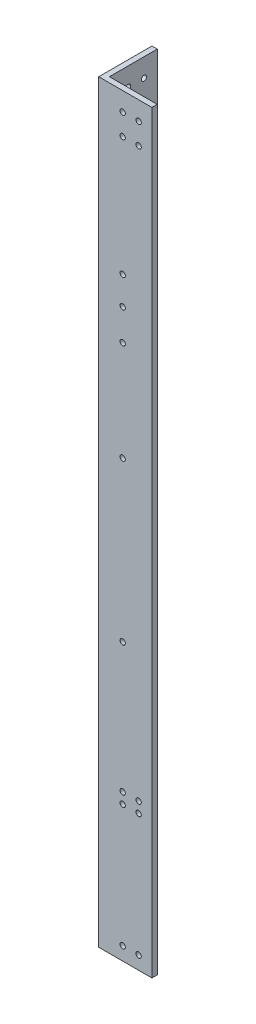
from build123d import *

# Parameters (mm, degrees)
BOSS_EXTRUDE1_DEPTH               = 450
FRONTSIDEHOLES_SKETCH3_R          = 1.5875
FRONTSIDEHOLES_CUT_EXTRUDE1_DEPTH = 3.175
LEFTSIDEHOLES_SKETCH4_R           = 1.5875
LEFTSIDEHOLES_CUT_EXTRUDE2_DEPTH  = 3.175


with BuildPart() as part:
    # Sketch2 → Boss-Extrude1 (new body)
    with BuildSketch(Plane(origin=(0, 0, 0), x_dir=(1, 0, 0), z_dir=(0, 1, 0))):
        Polygon((0, 31.75), (3.175, 31.75), (3.175, 3.175), (31.75, 3.175), (31.75, 0), (0, 0), align=None)
    extrude(amount=BOSS_EXTRUDE1_DEPTH)

    # FrontSideHoles-Sketch3 → FrontSideHoles-Cut-Extrude1 (cut)
    with BuildSketch(Plane.XY):
        with Locations((14.2875, 81.1125)):
            Circle(FRONTSIDEHOLES_SKETCH3_R)
        with Locations((23.8125, 81.1125)):
            Circle(FRONTSIDEHOLES_SKETCH3_R)
        with Locations((14.2875, 87.4625)):
            Circle(FRONTSIDEHOLES_SKETCH3_R)
        with Locations((23.8125, 87.4625)):
            Circle(FRONTSIDEHOLES_SKETCH3_R)
        with Locations((14.2875, 438.8875)):
            Circle(FRONTSIDEHOLES_SKETCH3_R)
        with Locations((14.2875, 426.1875)):
            Circle(FRONTSIDEHOLES_SKETCH3_R)
        with Locations((23.8125, 438.8875)):
            Circle(FRONTSIDEHOLES_SKETCH3_R)
        with Locations((23.8125, 426.1875)):
            Circle(FRONTSIDEHOLES_SKETCH3_R)
        with Locations((14.2875, 338.177644)):
            Circle(FRONTSIDEHOLES_SKETCH3_R)
        with Locations((14.2875, 319.652644)):
            Circle(FRONTSIDEHOLES_SKETCH3_R)
        with Locations((14.2875, 260)):
            Circle(FRONTSIDEHOLES_SKETCH3_R)
        with Locations((14.2875, 165)):
            Circle(FRONTSIDEHOLES_SKETCH3_R)
        with Locations((14.2875, 355)):
            Circle(FRONTSIDEHOLES_SKETCH3_R)
        with Locations((14.2875, 7.9375)):
            Circle(FRONTSIDEHOLES_SKETCH3_R)
        with Locations((23.8125, 7.9375)):
            Circle(FRONTSIDEHOLES_SKETCH3_R)
    extrude(amount=-FRONTSIDEHOLES_CUT_EXTRUDE1_DEPTH, mode=Mode.SUBTRACT)

    # LeftSideHoles-Sketch4 → LeftSideHoles-Cut-Extrude2 (cut)
    with BuildSketch(Plane.ZY):
        with Locations((-23.8125, 81.1125)):
            Circle(LEFTSIDEHOLES_SKETCH4_R)
        with Locations((-14.2875, 81.1125)):
            Circle(LEFTSIDEHOLES_SKETCH4_R)
        with Locations((-23.8125, 87.4625)):
            Circle(LEFTSIDEHOLES_SKETCH4_R)
        with Locations((-14.2875, 87.4625)):
            Circle(LEFTSIDEHOLES_SKETCH4_R)
        with Locations((-23.8125, 438.8875)):
            Circle(LEFTSIDEHOLES_SKETCH4_R)
        with Locations((-14.2875, 438.8875)):
            Circle(LEFTSIDEHOLES_SKETCH4_R)
        with Locations((-23.8125, 426.1875)):
            Circle(LEFTSIDEHOLES_SKETCH4_R)
        with Locations((-14.2875, 426.1875)):
            Circle(LEFTSIDEHOLES_SKETCH4_R)
        with Locations((-23.8125, 332.602644)):
            Circle(LEFTSIDEHOLES_SKETCH4_R)
        with Locations((-14.2875, 332.602644)):
            Circle(LEFTSIDEHOLES_SKETCH4_R)
        with Locations((-23.8125, 319.902644)):
            Circle(LEFTSIDEHOLES_SKETCH4_R)
        with Locations((-14.2875, 319.902644)):
            Circle(LEFTSIDEHOLES_SKETCH4_R)
        with Locations((-23.8125, 7.9375)):
            Circle(LEFTSIDEHOLES_SKETCH4_R)
        with Locations((-14.2875, 7.9375)):
            Circle(LEFTSIDEHOLES_SKETCH4_R)
        with Locations((-14.2875, 165)):
            Circle(LEFTSIDEHOLES_SKETCH4_R)
        with Locations((-14.2875, 260)):
            Circle(LEFTSIDEHOLES_SKETCH4_R)
        with Locations((-14.2875, 355)):
            Circle(LEFTSIDEHOLES_SKETCH4_R)
    extrude(amount=-LEFTSIDEHOLES_CUT_EXTRUDE2_DEPTH, mode=Mode.SUBTRACT)


solid = part.part
